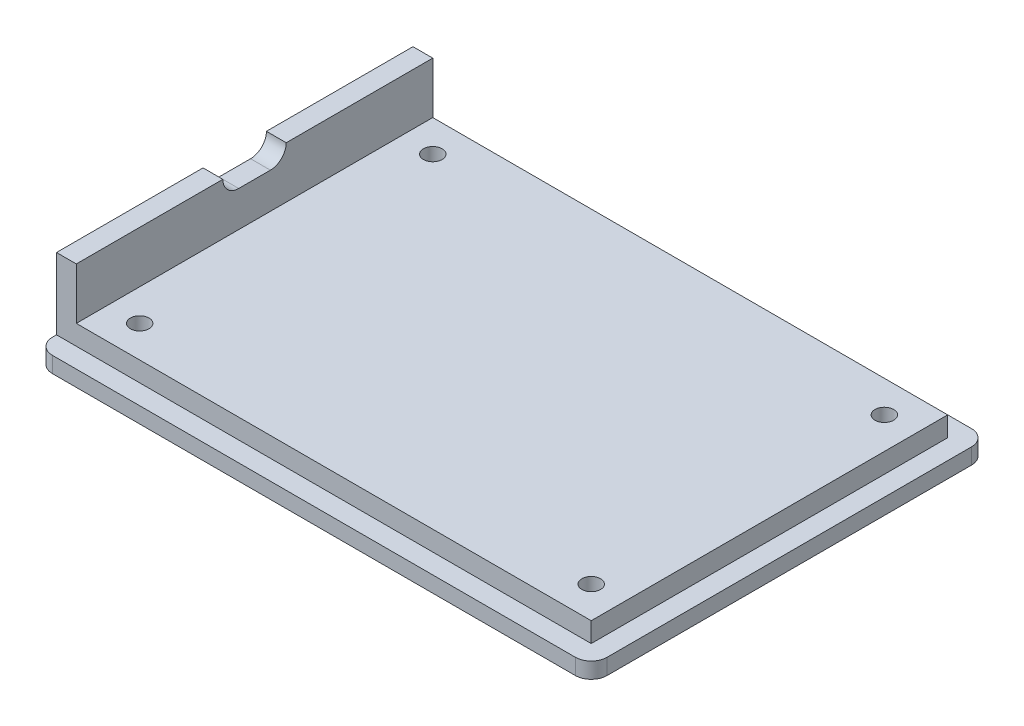
from build123d import *

# Parameters (mm, degrees)
SKETCH1_W           = 82.55
SKETCH1_H           = 57.15
BOSS_EXTRUDE2_DEPTH = 5.715
SKETCH1_7_W         = 88.9
SKETCH1_7_H         = 63.5
SKETCH1_7_W_2       = 82.55
SKETCH1_7_H_2       = 57.15
TOP_DEPTH           = 2.54
FRONTLIP_DEPTH      = 3.175
SKETCH4_R           = 1.5
M3SCREWHOLE_DEPTH   = 13.208
FILLET1_R           = 2.54
SKETCH5_R           = 3.5
SCREWHEADHOLE_DEPTH = 3.175


with BuildPart() as part:
    # Sketch1 → Boss-Extrude2 (new body)
    with BuildSketch(Plane(origin=(0, 0, 0), x_dir=(1, 0, 0), z_dir=(0, 1, 0))):
        Rectangle(SKETCH1_W, SKETCH1_H)
    extrude(amount=BOSS_EXTRUDE2_DEPTH)

    # Sketch1<7> → Top (add)
    with BuildSketch(Plane(origin=(0, 0, 0), x_dir=(1, 0, 0), z_dir=(0, 1, 0))):
        Rectangle(SKETCH1_7_W, SKETCH1_7_H)
        Rectangle(SKETCH1_7_W_2, SKETCH1_7_H_2, mode=Mode.SUBTRACT)
    extrude(amount=TOP_DEPTH)

    # Sketch3 → FrontLip (add)
    with BuildSketch(Plane.ZY.offset(44.45)):
        Polygon((-28.575, 2.54), (28.575, 2.54), (28.575, 13.97), (5.08, 13.97), (5.08, 11.43), (-5.08, 11.43), (-5.08, 13.97), (-28.575, 13.97), align=None)
    extrude(amount=-FRONTLIP_DEPTH)

    # Sketch4 → M3ScrewHole (cut)
    with BuildSketch(Plane(origin=(0, 5.715, 0), x_dir=(1, 0, 0), z_dir=(0, 1, 0))):
        with Locations(Location((-36.195, 23.495, 0), (0, 0, 270))):
            Circle(SKETCH4_R)
        with Locations(Location((36.195, 23.495, 0), (0, 0, 270))):
            Circle(SKETCH4_R)
        with Locations(Location((36.195, -23.495, 0), (0, 0, 270))):
            Circle(SKETCH4_R)
        with Locations(Location((-36.195, -23.495, 0), (0, 0, 270))):
            Circle(SKETCH4_R)
    extrude(amount=-M3SCREWHOLE_DEPTH, mode=Mode.SUBTRACT)

    # Fillet1
    fillet1_edges = [part.edges().sort_by_distance(p)[0] for p in [
        (-42.8625, 11.43, -5.08),
        (-42.8625, 11.43, 5.08),
        (44.45, 1.27, 31.75),
        (44.45, 1.27, -31.75),
        (-44.45, 1.27, 31.75),
        (-44.45, 1.27, -31.75),
    ]]
    fillet(fillet1_edges, radius=FILLET1_R - 0.0001)  # a hair under: the kernel refuses the full size

    # Sketch5 → ScrewHeadHole (cut)
    with BuildSketch(Plane.XZ):
        with Locations(Location((-36.195, 23.495, 0), (0, 0, 270))):
            Circle(SKETCH5_R)
        with Locations(Location((-36.195, -23.495, 0), (0, 0, 270))):
            Circle(SKETCH5_R)
        with Locations(Location((36.195, -23.495, 0), (0, 0, 270))):
            Circle(SKETCH5_R)
        with Locations(Location((36.195, 23.495, 0), (0, 0, 270))):
            Circle(SKETCH5_R)
    extrude(amount=-SCREWHEADHOLE_DEPTH, mode=Mode.SUBTRACT)


solid = part.part
